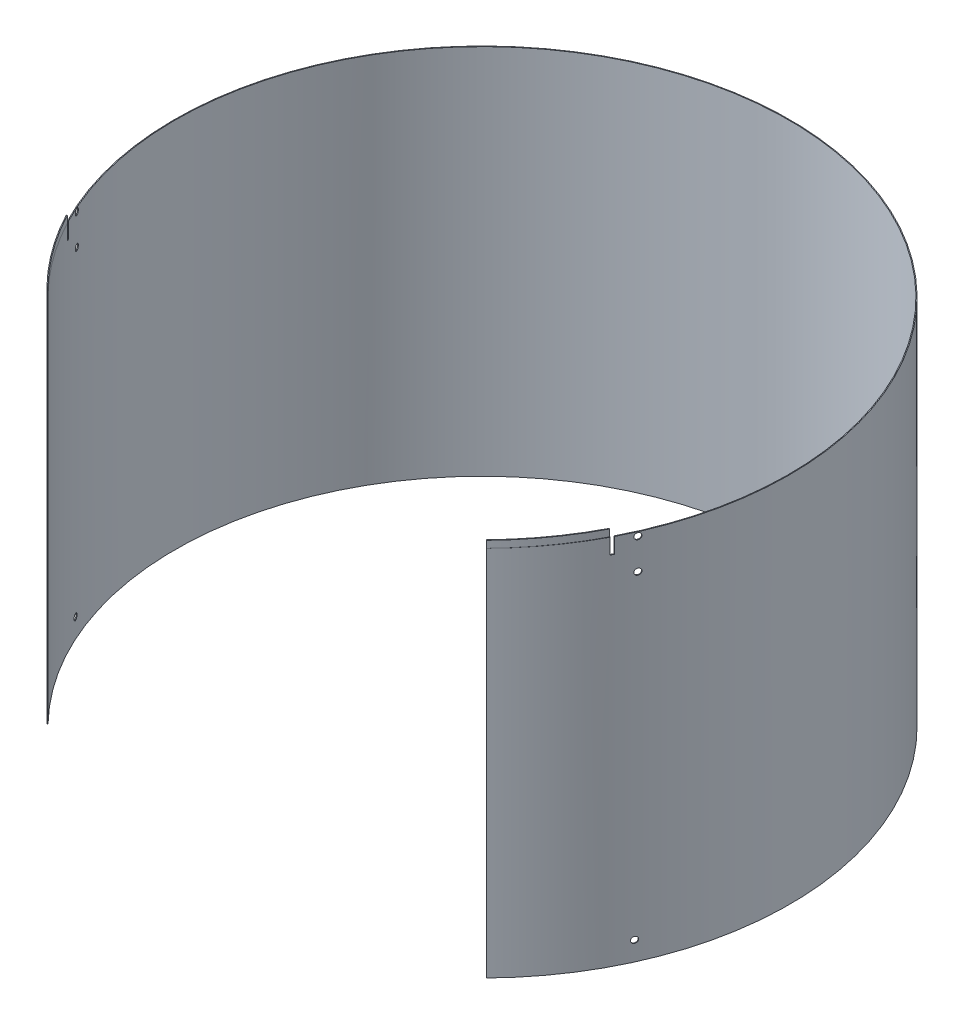
from build123d import *

# Parameters (mm, degrees)
SM_BASE_FLANGE_1_DEPTH = 485
CUT_EXTRUDE_START      = -20.154266119
CUT_EXTRUDE_5_DEPTH    = 20.154266119
SM_START               = 9
SM_BASE_FLANGE_3_DEPTH = 9
SM_BASE_FLANGE_4_DEPTH = 9
SKETCH_12_R            = 4
CUT_EXTRUDE_6_DEPTH    = 80


# Read off the part's stored shape, not the designer's step: Вырез-Вытянуть5
# Sheet-metal steps are written as plain solids
with BuildPart() as part:
    # Sketch 1 → Базовая кромка1 (new body)
    with BuildSketch(Plane(origin=(0, 0, 0), x_dir=(1, 0, 0), z_dir=(0, 1, 0))):
        with BuildLine():
            ThreePointArc((-286.564771423, -280.502463054), (-372.783196213, -147.762270629), (-400.920191559, 8))
            ThreePointArc((-400.920191559, 8), (0, 401), (400.920191559, 8))
            ThreePointArc((400.920191559, 8), (372.783196213, -147.762270629), (286.564771423, -280.502463054))
            Line((286.564771423, -280.502463054), (285.850146058, -279.802955665))
            ThreePointArc((285.850146058, -279.802955665), (371.853562307, -147.393786163), (399.920390583, 7.980049875))
            ThreePointArc((399.920390583, 7.980049875), (0, 400), (-399.920390583, 7.980049875))
            ThreePointArc((-399.920390583, 7.980049875), (-371.853562307, -147.393786163), (-285.850146058, -279.802955665))
            Line((-285.850146058, -279.802955665), (-286.564771423, -280.502463054))
        make_face()
    extrude(amount=-SM_BASE_FLANGE_1_DEPTH)

    # Вырез-Вытянуть5 outline → Вырез-Вытянуть5 (cut)
    with BuildSketch(Plane(origin=(0, 0, 0), x_dir=(1, 0, 0), z_dir=(0, 1, 0)).offset(CUT_EXTRUDE_START)):
        with BuildLine():
            Line((353.641413762, -186.916426438), (354.525517296, -187.383717505))
            ThreePointArc((354.525517296, -187.383717505), (355.435269498, -185.652280345), (356.336565744, -183.916426438))
            Line((356.336565744, -183.916426438), (355.447945879, -183.457781984))
            ThreePointArc((355.447945879, -183.457781984), (354.548897255, -185.189307077), (353.641413762, -186.916426438))
        make_face()
        with BuildLine():
            Line((-355.447945879, -183.457781984), (-356.336565744, -183.916426438))
            ThreePointArc((-356.336565744, -183.916426438), (-355.435269498, -185.652280345), (-354.525517296, -187.383717505))
            Line((-354.525517296, -187.383717505), (-353.641413762, -186.916426438))
            ThreePointArc((-353.641413762, -186.916426438), (-354.548897255, -185.189307077), (-355.447945879, -183.457781984))
        make_face()
    extrude(amount=CUT_EXTRUDE_5_DEPTH, mode=Mode.SUBTRACT)

    # Эскиз12 → Вырез-Вытянуть6 (cut)
    with BuildSketch(Plane(origin=(-379.218196518, 0, 153.214096707), x_dir=(0.37460659341590985, 0, 0.9271838545667883), z_dir=(-0.9271838545667883, 0, 0.37460659341590985))):
        with Locations((14, -45.154266119)):
            Circle(SKETCH_12_R)
        with Locations((14, -5.154266119)):
            Circle(SKETCH_12_R)
        with Locations((17.325607974, -460)):
            Circle(SKETCH_12_R)
    cut_extrude_6 = extrude(amount=-CUT_EXTRUDE_6_DEPTH, mode=Mode.SUBTRACT)

    # Зеркальное отражение2: Вырез-Вытянуть6 across plane
    add(cut_extrude_6.mirror(Plane(origin=(0, 0, 0), x_dir=(0, 0, 1), z_dir=(1, 0, 0))), mode=Mode.SUBTRACT)


with BuildPart() as body_2:
    # Эскиз9 → Базовая кромка3 (new body)
    with BuildSketch(Plane(origin=(0, 0, 0), x_dir=(1, 0, 0), z_dir=(0, 1, 0)).offset(SM_START)):
        with BuildLine():
            ThreePointArc((-353.641413762, -186.916426438), (-323.101130605, -235.808522751), (-285.850146058, -279.802955665))
            Line((-285.850146058, -279.802955665), (-286.564771423, -280.502463054))
            ThreePointArc((-286.564771423, -280.502463054), (-323.908883431, -236.398044058), (-354.525517296, -187.383717505))
            Line((-354.525517296, -187.383717505), (-353.641413762, -186.916426438))
        make_face()
    extrude(amount=-SM_BASE_FLANGE_3_DEPTH)


with BuildPart() as body_3:
    # Эскиз11 → Базовая кромка4 (new body)
    with BuildSketch(Plane(origin=(0, 0, 0), x_dir=(1, 0, 0), z_dir=(0, 1, 0))):
        with BuildLine():
            ThreePointArc((285.845982484, -279.807234702), (322.758831311, -235.778915861), (352.983132723, -186.916426438))
            Line((352.983132723, -186.916426438), (353.869168307, -187.380043678))
            ThreePointArc((353.869168307, -187.380043678), (323.569306141, -236.364689324), (286.564175192, -280.503078962))
            Line((286.564175192, -280.503078962), (285.845982484, -279.807234702))
        make_face()
    extrude(amount=SM_BASE_FLANGE_4_DEPTH)


solid = Compound([part.part, body_2.part, body_3.part])
